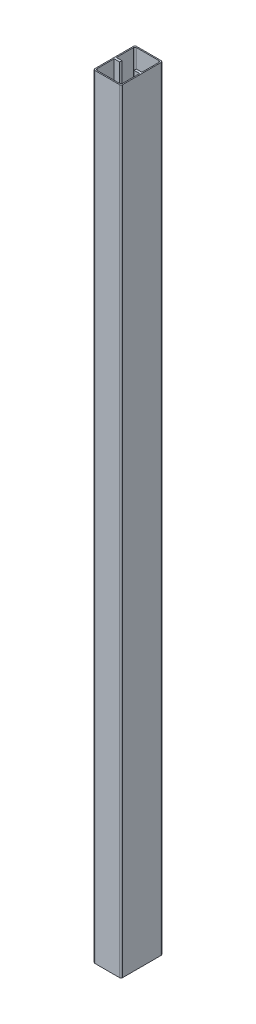
from build123d import *

# Parameters (mm, degrees)
ESBO_O1_W                = 100
ESBO_O1_H                = 150
RESSALTO_EXTRUS_O1_DEPTH = 2782.55
FILETE1_R                = 6


with BuildPart() as part:
    # Esboço1 → Ressalto-extrusão1 (new body)
    with BuildSketch(Plane(origin=(0, 0, 0), x_dir=(1, 0, 0), z_dir=(0, 1, 0))):
        Rectangle(ESBO_O1_W, ESBO_O1_H)
        Polygon((-46, 71), (-46, 4), (-26, 4), (-26, -4), (-46, -4), (-46, -71), (46, -71), (46, -4), (26, -4), (26, 4), (46, 4), (46, 71), align=None, mode=Mode.SUBTRACT)
    extrude(amount=RESSALTO_EXTRUS_O1_DEPTH)

    # Filete1
    filete1_edges = [part.edges().sort_by_distance(p)[0] for p in [
        (-50, 1391.275, -75),
        (50, 1391.275, 75),
        (46, 1391.275, 71),
        (-46, 1391.275, 71),
        (46, 1391.275, -71),
        (50, 1391.275, -75),
        (-50, 1391.275, 75),
        (-46, 1391.275, -71),
    ]]
    fillet(filete1_edges, radius=FILETE1_R)


solid = part.part
